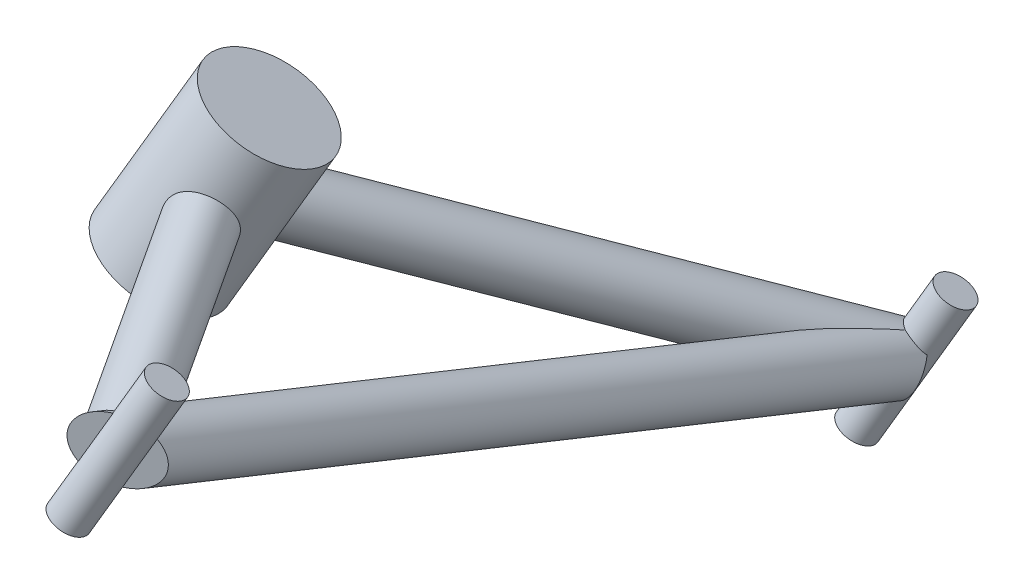
from build123d import *

# Parameters (mm, degrees)
SUSP_FR_ROCKER_BOSS_PROFILE_R        = 16
SUSP_FR_ROCKER_ARM_ROD_PROFILE_R     = 8
SUSP_FR_ROCKER_ARM_DAMPER_PROFILE_R  = 8
SUSP_FR_ROCKER_EDGE_START            = 189.061745428
SUSP_FR_ROCKER_EDGE_DEPTH            = 192.416031784
SUSP_FR_ROCKER_EDGE_START_2          = 174.963373543
SUSP_FR_ROCKER_EDGE_2_DEPTH          = 225.199154648
SUSP_FR_ROCKER_EDGE_START_3          = 194
SUSP_FR_ROCKER_EDGE_3_DEPTH          = 18
SUSP_FR_ROCKER_BOLT_ROD_PROFILE_R    = 5
SUSP_FR_ROCKER_BOLT_DAMPER_PROFILE_R = 5


with BuildPart() as part:
    # SUSP_FR_rocker_boss: sweep along a curve in space
    with BuildLine() as susp_fr_rocker_boss_path:
        Line((282.547385, -0.733505554, -246.568112), (300.152615, 37.6935056, -258.791888))
    # SUSP_FR_rocker_boss profile (on start of the path) → SUSP_FR_rocker_boss (sweep)
    with BuildSketch(Plane(origin=(282.547385, -0.733505554, -246.568112), x_dir=(0.9091288848209244, -0.4165149106385777, 0), z_dir=(0.40011886267732827, 0.8733411604976153, -0.27781309024320666))):
        Circle(SUSP_FR_ROCKER_BOSS_PROFILE_R)
    sweep(path=susp_fr_rocker_boss_path.line)

    # SUSP_FR_rocker_arm_rod: sweep along a curve in space
    with BuildLine() as susp_fr_rocker_arm_rod_path:
        Line((291.35, 18.48, -252.68), (343.0563, 19.7951, -174.0819))
    # SUSP_FR_rocker_arm_rod profile (on start of the path) → SUSP_FR_rocker_arm_rod (sweep)
    with BuildSketch(Plane(origin=(291.35, 18.48, -252.68), x_dir=(0.8354316077828569, 0, -0.5495944220216861), z_dir=(0.5495407356632377, 0.013977039963616102, 0.8353499998207716))):
        Circle(SUSP_FR_ROCKER_ARM_ROD_PROFILE_R)
    sweep(path=susp_fr_rocker_arm_rod_path.line)

    # SUSP_FR_rocker_arm_damper: sweep along a curve in space
    with BuildLine() as susp_fr_rocker_arm_damper_path:
        Line((291.35, 18.48, -252.68), (358.6363, -51.5672, -375.9713))
    # SUSP_FR_rocker_arm_damper profile (on start of the path) → SUSP_FR_rocker_arm_damper (sweep)
    with BuildSketch(Plane(origin=(291.35, 18.48, -252.68), x_dir=(0, -0.8694707178179945, 0.4939844844294824), z_dir=(0.4286986520155411, -0.4462890695054271, -0.7855211850739852))):
        Circle(SUSP_FR_ROCKER_ARM_DAMPER_PROFILE_R)
    sweep(path=susp_fr_rocker_arm_damper_path.line)

    # SUSP_FR_rocker_edge: read off the stored shape, not the designer's step
    # SUSP_FR_rocker_edge outline → SUSP_FR_rocker_edge (add)
    with BuildSketch(Plane(origin=(0, 0, 0), x_dir=(0.9973635027009122, 0.024184235010770924, 0.0684190489345709), z_dir=(0.07256750981098502, -0.33238667557024604, -0.9403473052139792)).offset(SUSP_FR_ROCKER_EDGE_START)):
        with BuildLine():
            ThreePointArc((333.929360291, -84.006985003), (338.048092541, -73.469620786), (327.510728324, -69.350888535))
            ThreePointArc((327.510728324, -69.350888535), (323.391996073, -79.888252753), (333.929360291, -84.006985003))
        make_face()
    extrude(amount=SUSP_FR_ROCKER_EDGE_DEPTH)

    # SUSP_FR_rocker_edge 2 outline → SUSP_FR_rocker_edge 2 (add)
    with BuildSketch(Plane(origin=(0, 0, 0), x_dir=(0.9973635027009122, 0.024184235010770924, 0.0684190489345709), z_dir=(0.07256750981098502, -0.33238667557024604, -0.9403473052139792)).offset(SUSP_FR_ROCKER_EDGE_START_2)):
        with BuildLine():
            ThreePointArc((333.929360291, -84.006985003), (338.048092541, -73.469620786), (327.510728324, -69.350888535))
            ThreePointArc((327.510728324, -69.350888535), (323.391996073, -79.888252753), (333.929360291, -84.006985003))
        make_face()
    extrude(amount=SUSP_FR_ROCKER_EDGE_2_DEPTH)

    # SUSP_FR_rocker_edge 3 outline → SUSP_FR_rocker_edge 3 (cut)
    with BuildSketch(Plane(origin=(0, 0, 0), x_dir=(0.9164685076710494, -0.38127917426634766, 0.12129165559910433), z_dir=(0.40010682879351067, 0.8733426442623042, -0.27782575702358253)).offset(SUSP_FR_ROCKER_EDGE_START_3)):
        Polygon((295.036751963, 377.987829908), (310.439633353, 369.835936687), (312, 369.010120921), (312, 376.640420956), (310.986515198, 376.720923139), align=None)
        Polygon((312, 151), (312, 179.566699334), (294.271202019, 166.282954159), (277.20510611, 153.495755082), (308.625494393, 151), align=None)
    extrude(amount=SUSP_FR_ROCKER_EDGE_3_DEPTH, mode=Mode.SUBTRACT)

    # SUSP_FR_rocker_bolt_rod: sweep along a curve in space
    with BuildLine() as susp_fr_rocker_bolt_rod_path:
        Line((335.053923, 2.32827677, -168.525638), (351.058677, 37.2619232, -179.638162))
    # SUSP_FR_rocker_bolt_rod profile (on start of the path) → SUSP_FR_rocker_bolt_rod (sweep)
    with BuildSketch(Plane(origin=(335.053923, 2.32827677, -168.525638), x_dir=(0.9091288898636867, -0.41651489963171856, 0), z_dir=(0.4001188508568365, 0.8733411626202211, -0.27781310059492387))):
        Circle(SUSP_FR_ROCKER_BOLT_ROD_PROFILE_R)
    sweep(path=susp_fr_rocker_bolt_rod_path.line)

    # SUSP_FR_rocker_bolt_damper: sweep along a curve in space
    with BuildLine() as susp_fr_rocker_bolt_damper_path:
        Line((350.633923, -69.0340232, -370.415038), (366.638677, -34.1003768, -381.527562))
    # SUSP_FR_rocker_bolt_damper profile (on start of the path) → SUSP_FR_rocker_bolt_damper (sweep)
    with BuildSketch(Plane(origin=(350.633923, -69.0340232, -370.415038), x_dir=(0.9091288897282415, -0.4165148999273554, 0), z_dir=(0.4001188511189165, 0.8733411624422646, -0.27781310077689364))):
        Circle(SUSP_FR_ROCKER_BOLT_DAMPER_PROFILE_R)
    sweep(path=susp_fr_rocker_bolt_damper_path.line)


solid = part.part
